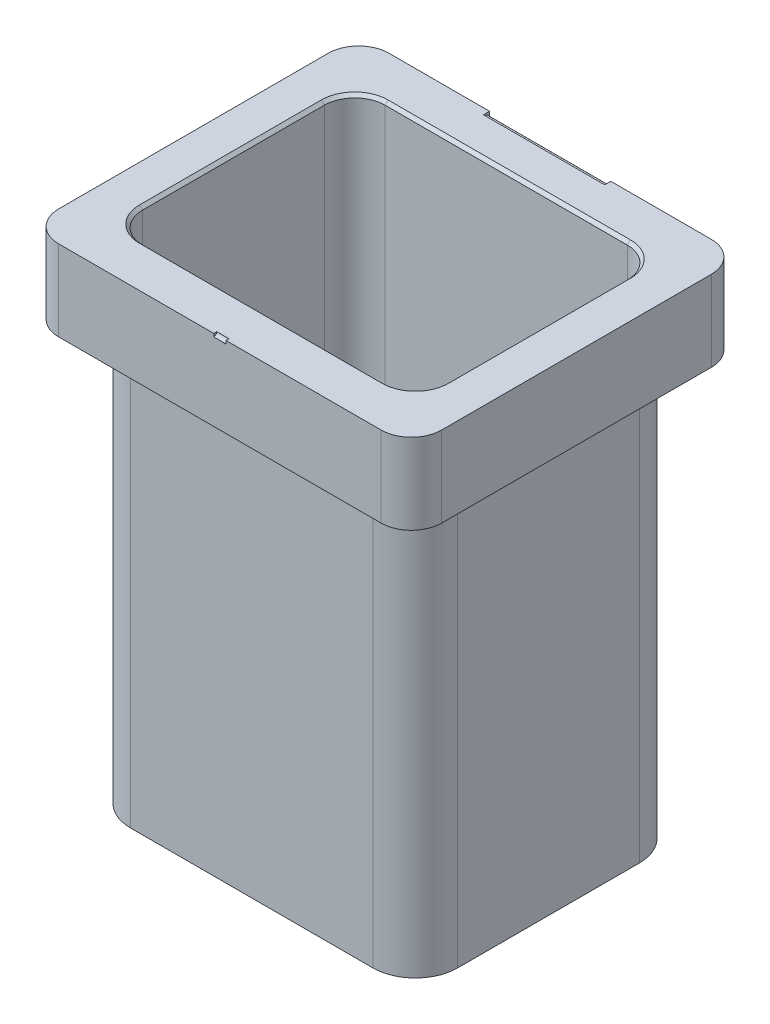
from build123d import *

# Parameters (mm, degrees)
BOSS_EXTRUDE1_DEPTH             = 800
SHELL1_T                        = 20
FILLET1_R                       = 10
SKETCH2_W                       = 30
SKETCH2_H                       = 40.435969651
SKETCH2_W_2                     = 30.005971622
BOSS_EXTRUDE2_DEPTH             = 50
SKETCH3_R                       = 10
CUT_EXTRUDE1_DEPTH              = 91
SKETCH4_W                       = 55.917258457
SKETCH4_H                       = 29.702669957
BOSS_EXTRUDE3_DEPTH             = 46
SKETCH5_R                       = 7.963396182
SKETCH5_R_2                     = 2.238128569
BOSS_EXTRUDE4_DEPTH             = 105
CHAMFER1_SIZE                   = 5
BOSS_EXTRUDE5_DEPTH             = 8
BOSS_EXTRUDE5_DEPTH_BACK        = 125
CUT_EXTRUDE5_REACH              = 929.198
CUT_EXTRUDE8_DEPTH              = 100
CUT_EXTRUDE8_DEPTH_BACK         = 100
SKETCH13_R                      = 7.090708657
BOSS_EXTRUDE6_REACH             = 911.382
SKETCH15_R                      = 1.988865479
BOSS_EXTRUDE6_DIRECTION_2_REACH = 911.382
CUT_EXTRUDE9_DEPTH              = 10
CUT_EXTRUDE9_DEPTH_BACK         = 10
SKETCH16_R                      = 5
CHAMFER2_SIZE                   = 5


with BuildPart() as part:
    # Sketch1 → Boss-Extrude1 (new body)
    with BuildSketch(Plane(origin=(0, 0, 0), x_dir=(1, 0, 0), z_dir=(0, 1, 0))):
        with BuildLine():
            Line((-200, 200), (200, 200))
            ThreePointArc((200, 200), (235.355339059, 185.355339059), (250, 150))
            Line((250, 150), (250, -150))
            ThreePointArc((250, -150), (235.355339059, -185.355339059), (200, -200))
            Line((200, -200), (-200, -200))
            ThreePointArc((-200, -200), (-235.355339059, -185.355339059), (-250, -150))
            Line((-250, -150), (-250, 150))
            ThreePointArc((-250, 150), (-235.355339059, 185.355339059), (-200, 200))
        make_face()
    extrude(amount=BOSS_EXTRUDE1_DEPTH)

    # Shell1
    shell1_openings = [part.faces().sort_by_distance(p)[0] for p in [
        (0, 800, 0),
    ]]
    offset(amount=SHELL1_T, openings=shell1_openings, kind=Kind.INTERSECTION)

    # Fillet1
    # the kernel refuses this fillet: 10 mm, written as the material it takes off along each edge
    with BuildSketch(Plane(origin=(-200, 800, 150), x_dir=(0, 0, 1), z_dir=(1, 0, 0))) as fillet1_piece_1:
        with BuildLine():
            CenterArc((50 + FILLET1_R, FILLET1_R), FILLET1_R, 180, 90)
            Line((50 + FILLET1_R, 0), (50, 0))
            Line((50, 0), (50, FILLET1_R))
        make_face()
    revolve(axis=Axis((-200, 800, 150), (0, -1, 0)), revolution_arc=90, mode=Mode.SUBTRACT)
    with BuildSketch(Plane(origin=(200, 800, 200), x_dir=(0, -1, 0), z_dir=(-1, 0, 0)), Plane(origin=(-200, 800, -200), x_dir=(0, -1, 0), z_dir=(1, 0, 0))) as fillet1_piece_2:
        with BuildLine():
            CenterArc((FILLET1_R, FILLET1_R), FILLET1_R, 180, 90)
            Line((0, FILLET1_R), (0, 0))
            Line((0, 0), (FILLET1_R, 0))
        make_face()
    extrude(amount=400, mode=Mode.SUBTRACT)
    with BuildSketch(Plane(origin=(200, 800, 150), x_dir=(1, 0, 0), z_dir=(0, 0, -1))) as fillet1_piece_3:
        with BuildLine():
            CenterArc((50 + FILLET1_R, FILLET1_R), FILLET1_R, 180, 90)
            Line((50 + FILLET1_R, 0), (50, 0))
            Line((50, 0), (50, FILLET1_R))
        make_face()
    revolve(axis=Axis((200, 800, 150), (0, -1, 0)), revolution_arc=90, mode=Mode.SUBTRACT)
    with BuildSketch(Plane(origin=(250, 800, -150), x_dir=(0, -1, 0), z_dir=(0, 0, 1)), Plane(origin=(-250, 800, 150), x_dir=(0, -1, 0), z_dir=(0, 0, -1))) as fillet1_piece_4:
        with BuildLine():
            CenterArc((FILLET1_R, FILLET1_R), FILLET1_R, 180, 90)
            Line((0, FILLET1_R), (0, 0))
            Line((0, 0), (FILLET1_R, 0))
        make_face()
    extrude(amount=300, mode=Mode.SUBTRACT)
    with BuildSketch(Plane(origin=(200, 800, -150), x_dir=(0, 0, -1), z_dir=(-1, 0, 0))) as fillet1_piece_5:
        with BuildLine():
            CenterArc((50 + FILLET1_R, FILLET1_R), FILLET1_R, 180, 90)
            Line((50 + FILLET1_R, 0), (50, 0))
            Line((50, 0), (50, FILLET1_R))
        make_face()
    revolve(axis=Axis((200, 800, -150), (0, -1, 0)), revolution_arc=90, mode=Mode.SUBTRACT)
    with BuildSketch(Plane(origin=(-200, 800, -150), x_dir=(-1, 0, 0), z_dir=(0, 0, 1))) as fillet1_piece_6:
        with BuildLine():
            CenterArc((50 + FILLET1_R, FILLET1_R), FILLET1_R, 180, 90)
            Line((50 + FILLET1_R, 0), (50, 0))
            Line((50, 0), (50, FILLET1_R))
        make_face()
    revolve(axis=Axis((-200, 800, -150), (0, -1, 0)), revolution_arc=90, mode=Mode.SUBTRACT)

    # Sketch2 → Boss-Extrude2 (add)
    with BuildSketch(Plane(origin=(0, 0, -220), x_dir=(-1, 0, 0), z_dir=(0, 0, -1))):
        with Locations((-30.002985811, 779.782015174)):
            Rectangle(SKETCH2_W, SKETCH2_H)
        with Locations((30, 779.782015174)):
            Rectangle(SKETCH2_W_2, SKETCH2_H)
    extrude(amount=BOSS_EXTRUDE2_DEPTH)

    # Sketch3 → Cut-Extrude1 (cut)
    with BuildSketch(Plane(origin=(45.002985811, 0, 0), x_dir=(0, 0, -1), z_dir=(1, 0, 0))):
        with Locations((245, 779.782015175)):
            Circle(SKETCH3_R)
        with BuildLine():
            Line((245, 800), (270, 800))
            Line((270, 800), (270, 759.564030349))
            Line((270, 759.564030349), (245, 759.564030349))
            ThreePointArc((245, 759.564030349), (265.217984825, 779.782015175), (245, 800))
        make_face()
    extrude(amount=-CUT_EXTRUDE1_DEPTH, mode=Mode.SUBTRACT)

    # Sketch4 → Boss-Extrude3 (add)
    with BuildSketch(Plane(origin=(0, 0, -220), x_dir=(-1, 0, 0), z_dir=(0, 0, -1))):
        with Locations((-87.655186212, 779.782015174)):
            Rectangle(SKETCH4_W, SKETCH4_H)
    extrude(amount=BOSS_EXTRUDE3_DEPTH)

    # Sketch5 → Boss-Extrude4 (add)
    with BuildSketch(Plane.ZY.offset(-59.696556983)):
        with Locations(Location((-245, 779.782015175, 0), (0, 0, 180))):
            Circle(SKETCH5_R)
        with Locations((-245, 779.782015175)):
            Circle(SKETCH5_R_2, mode=Mode.SUBTRACT)
    extrude(amount=BOSS_EXTRUDE4_DEPTH)

    # Chamfer1
    chamfer1_edges = [part.edges().sort_by_distance(p)[0] for p in [
        (87.655186211, 794.633350153, -266),
        (87.655186211, 764.930680196, -266),
    ]]
    chamfer(chamfer1_edges, length=CHAMFER1_SIZE)

    # Sketch8 → Boss-Extrude5 (add, two sides: drawn at the far end of the back side and taken through both)
    with BuildSketch(Plane(origin=(0, 800, 0), x_dir=(1, 0, 0), z_dir=(0, 1, 0)).offset(-BOSS_EXTRUDE5_DEPTH_BACK)):
        with BuildLine():
            Line((-266, 272.5), (266, 272.5))
            ThreePointArc((266, 272.5), (301.355339059, 257.855339059), (316, 222.5))
            Line((316, 222.5), (316, -222.5))
            ThreePointArc((316, -222.5), (301.355339059, -257.855339059), (266, -272.5))
            Line((266, -272.5), (-266, -272.5))
            ThreePointArc((-266, -272.5), (-301.355339059, -257.855339059), (-316, -222.5))
            Line((-316, -222.5), (-316, 222.5))
            ThreePointArc((-316, 222.5), (-301.355339059, 257.855339059), (-266, 272.5))
        make_face()
    extrude(amount=BOSS_EXTRUDE5_DEPTH + BOSS_EXTRUDE5_DEPTH_BACK)

    # Sketch11 → Cut-Extrude5 (cut, up to next)
    with BuildSketch(Plane(origin=(0, 808, 0), x_dir=(1, 0, 0), z_dir=(0, 1, 0)), mode=Mode.PRIVATE) as cut_extrude5_sk1:
        with BuildLine():
            Line((-200, -200), (200, -200))
            ThreePointArc((200, -200), (235.355339059, -185.355339059), (250, -150))
            Line((250, -150), (250, 150))
            ThreePointArc((250, 150), (235.355339059, 185.355339059), (200, 200))
            Line((200, 200), (-200, 200))
            ThreePointArc((-200, 200), (-235.355339059, 185.355339059), (-250, 150))
            Line((-250, 150), (-250, -150))
            ThreePointArc((-250, -150), (-235.355339059, -185.355339059), (-200, -200))
        make_face()
    cut_extrude5_tool1 = extrude(cut_extrude5_sk1.sketch, amount=-CUT_EXTRUDE5_REACH, mode=Mode.PRIVATE) & part.part
    add(cut_extrude5_tool1.solids().sort_by_distance((0, 808, 0))[0], mode=Mode.SUBTRACT)

    # Sketch13 → Cut-Extrude8 (cut, two sides: drawn at the far end of the back side and taken through both)
    with BuildSketch(Plane(origin=(0, 0, 0), x_dir=(0, 0, -1), z_dir=(1, 0, 0)).offset(-CUT_EXTRUDE8_DEPTH_BACK)):
        with Locations((267.5, 803)):
            Circle(SKETCH13_R)
    extrude(amount=CUT_EXTRUDE8_DEPTH + CUT_EXTRUDE8_DEPTH_BACK, mode=Mode.SUBTRACT)


with BuildPart() as body_2:

    # Sketch15 → Boss-Extrude6 (new, up to next)
    with BuildSketch(Plane(origin=(0, 0, 0), x_dir=(0, 0, -1), z_dir=(1, 0, 0)), mode=Mode.PRIVATE) as boss_extrude6_sk1:
        with Locations((267.5, 803)):
            Circle(SKETCH15_R)
    boss_extrude6_tool1 = extrude(boss_extrude6_sk1.sketch, amount=BOSS_EXTRUDE6_REACH, mode=Mode.PRIVATE) - part.part
    add(boss_extrude6_tool1.solids().sort_by_distance((0, 803, -267.5))[0])


    # Sketch15 → Boss-Extrude6 direction 2 (add, up to next)
    with BuildSketch(Plane(origin=(0, 0, 0), x_dir=(0, 0, -1), z_dir=(1, 0, 0)), mode=Mode.PRIVATE) as boss_extrude6_direction_2_sk1:
        with Locations((267.5, 803)):
            Circle(SKETCH15_R)
    boss_extrude6_direction_2_tool1 = extrude(boss_extrude6_direction_2_sk1.sketch, amount=-BOSS_EXTRUDE6_DIRECTION_2_REACH, mode=Mode.PRIVATE) - part.part
    add(boss_extrude6_direction_2_tool1.solids().sort_by_distance((0, 803, -267.5))[0])


with BuildPart() as part_1:
    add(part.part)

    # Sketch16 → Cut-Extrude9 (cut, two sides: drawn at the far end of the back side and taken through both)
    with BuildSketch(Plane(origin=(0, 0, 0), x_dir=(0, 0, -1), z_dir=(1, 0, 0)).offset(-CUT_EXTRUDE9_DEPTH_BACK)):
        with Locations((-272.5, 808)):
            Circle(SKETCH16_R)
    extrude(amount=CUT_EXTRUDE9_DEPTH + CUT_EXTRUDE9_DEPTH_BACK, mode=Mode.SUBTRACT)

    # Chamfer2
    chamfer2_edges = [part_1.edges().sort_by_distance(p)[0] for p in [
        (-235.355339059, 808, -185.355339059),
        (-250, 808, 0),
        (-235.355339059, 808, 185.355339059),
        (0, 808, 200),
        (235.355339059, 808, 185.355339059),
        (250, 808, 0),
        (235.355339059, 808, -185.355339059),
        (0, 808, -200),
    ]]
    chamfer(chamfer2_edges, length=CHAMFER2_SIZE)


solid = Compound([body_2.part, part_1.part])
